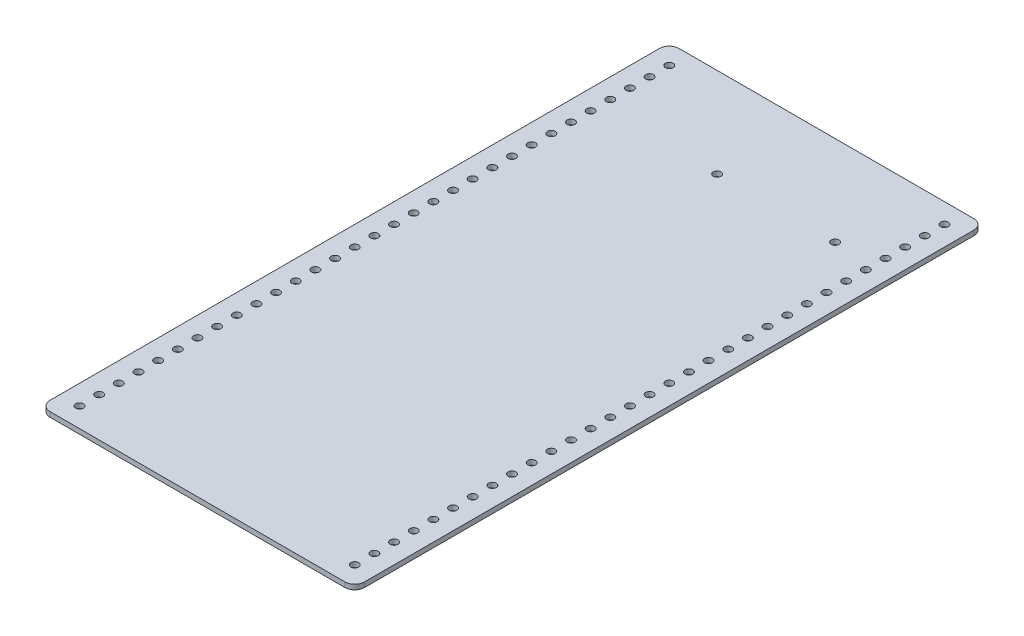
from build123d import *

# Parameters (mm, degrees)
BOSS_EXTRUDE1_DEPTH = 3.175
SKETCH3_R           = 2.5
CUT_EXTRUDE2_DEPTH  = 312.626023698
SKETCH7_R           = 2.5
CUT_EXTRUDE5_DEPTH  = 312.626023698


with BuildPart() as part:
    # Sketch1 → Boss-Extrude1 (new body)
    with BuildSketch(Plane(origin=(0, 0, 0), x_dir=(1, 0, 0), z_dir=(0, 1, 0))):
        with BuildLine():
            Line((-77.88977591, 288.008963585), (112.61022409, 288.008963585))
            ThreePointArc((112.61022409, 288.008963585), (117.10035215, 286.149091646), (118.96022409, 281.658963585))
            Line((118.96022409, 281.658963585), (118.96022409, -112.041036415))
            ThreePointArc((118.96022409, -112.041036415), (117.10035215, -116.531164475), (112.61022409, -118.391036415))
            Line((112.61022409, -118.391036415), (-77.88977591, -118.391036415))
            ThreePointArc((-77.88977591, -118.391036415), (-82.379903971, -116.531164475), (-84.23977591, -112.041036415))
            Line((-84.23977591, -112.041036415), (-84.23977591, 281.658963585))
            ThreePointArc((-84.23977591, 281.658963585), (-82.379903971, 286.149091646), (-77.88977591, 288.008963585))
        make_face()
    extrude(amount=BOSS_EXTRUDE1_DEPTH)

    # Sketch3 → Cut-Extrude2 (cut, through all)
    with BuildSketch(Plane(origin=(0, 3.175, 0), x_dir=(1, 0, 0), z_dir=(0, 1, 0))):
        with Locations((-71.53977591, 275.308963585)):
            Circle(SKETCH3_R)
        with Locations((106.26022409, 275.308963585)):
            Circle(SKETCH3_R)
        with Locations((-71.53977591, 262.608963585)):
            Circle(SKETCH3_R)
        with Locations((106.26022409, 262.608963585)):
            Circle(SKETCH3_R)
        with Locations((-71.53977591, 249.908963585)):
            Circle(SKETCH3_R)
        with Locations((106.26022409, 249.908963585)):
            Circle(SKETCH3_R)
        with Locations((-71.53977591, 237.208963585)):
            Circle(SKETCH3_R)
        with Locations((106.26022409, 237.208963585)):
            Circle(SKETCH3_R)
        with Locations((-71.53977591, 224.508963585)):
            Circle(SKETCH3_R)
        with Locations((106.26022409, 224.508963585)):
            Circle(SKETCH3_R)
        with Locations((-71.53977591, 211.808963585)):
            Circle(SKETCH3_R)
        with Locations((106.26022409, 211.808963585)):
            Circle(SKETCH3_R)
        with Locations((-71.53977591, 199.108963585)):
            Circle(SKETCH3_R)
        with Locations((106.26022409, 199.108963585)):
            Circle(SKETCH3_R)
        with Locations((-71.53977591, 186.408963585)):
            Circle(SKETCH3_R)
        with Locations((106.26022409, 186.408963585)):
            Circle(SKETCH3_R)
        with Locations((-71.53977591, 173.708963585)):
            Circle(SKETCH3_R)
        with Locations((106.26022409, 173.708963585)):
            Circle(SKETCH3_R)
        with Locations((-71.53977591, 161.008963585)):
            Circle(SKETCH3_R)
        with Locations((106.26022409, 161.008963585)):
            Circle(SKETCH3_R)
        with Locations((-71.53977591, 148.308963585)):
            Circle(SKETCH3_R)
        with Locations((106.26022409, 148.308963585)):
            Circle(SKETCH3_R)
        with Locations((-71.53977591, 135.608963585)):
            Circle(SKETCH3_R)
        with Locations((106.26022409, 135.608963585)):
            Circle(SKETCH3_R)
        with Locations((-71.53977591, 122.908963585)):
            Circle(SKETCH3_R)
        with Locations((106.26022409, 122.908963585)):
            Circle(SKETCH3_R)
        with Locations((-71.53977591, 110.208963585)):
            Circle(SKETCH3_R)
        with Locations((106.26022409, 110.208963585)):
            Circle(SKETCH3_R)
        with Locations((-71.53977591, 97.508963585)):
            Circle(SKETCH3_R)
        with Locations((106.26022409, 97.508963585)):
            Circle(SKETCH3_R)
        with Locations((-71.53977591, 84.808963585)):
            Circle(SKETCH3_R)
        with Locations((106.26022409, 84.808963585)):
            Circle(SKETCH3_R)
        with Locations((-71.53977591, 72.108963585)):
            Circle(SKETCH3_R)
        with Locations((106.26022409, 72.108963585)):
            Circle(SKETCH3_R)
        with Locations((-71.53977591, 59.408963585)):
            Circle(SKETCH3_R)
        with Locations((106.26022409, 59.408963585)):
            Circle(SKETCH3_R)
        with Locations((-71.53977591, 46.708963585)):
            Circle(SKETCH3_R)
        with Locations((106.26022409, 46.708963585)):
            Circle(SKETCH3_R)
        with Locations((-71.53977591, 34.008963585)):
            Circle(SKETCH3_R)
        with Locations((106.26022409, 34.008963585)):
            Circle(SKETCH3_R)
        with Locations((-71.53977591, 21.308963585)):
            Circle(SKETCH3_R)
        with Locations((106.26022409, 21.308963585)):
            Circle(SKETCH3_R)
        with Locations((-71.53977591, 8.608963585)):
            Circle(SKETCH3_R)
        with Locations((106.26022409, 8.608963585)):
            Circle(SKETCH3_R)
        with Locations((-71.53977591, -4.091036415)):
            Circle(SKETCH3_R)
        with Locations((106.26022409, -4.091036415)):
            Circle(SKETCH3_R)
        with Locations((-71.53977591, -16.791036415)):
            Circle(SKETCH3_R)
        with Locations((106.26022409, -16.791036415)):
            Circle(SKETCH3_R)
        with Locations((-71.53977591, -29.491036415)):
            Circle(SKETCH3_R)
        with Locations((106.26022409, -29.491036415)):
            Circle(SKETCH3_R)
        with Locations((-71.53977591, -42.191036415)):
            Circle(SKETCH3_R)
        with Locations((106.26022409, -42.191036415)):
            Circle(SKETCH3_R)
        with Locations((-71.53977591, -54.891036415)):
            Circle(SKETCH3_R)
        with Locations((106.26022409, -54.891036415)):
            Circle(SKETCH3_R)
        with Locations((-71.53977591, -67.591036415)):
            Circle(SKETCH3_R)
        with Locations((106.26022409, -67.591036415)):
            Circle(SKETCH3_R)
        with Locations((-71.53977591, -80.291036415)):
            Circle(SKETCH3_R)
        with Locations((106.26022409, -80.291036415)):
            Circle(SKETCH3_R)
        with Locations((-71.53977591, -92.991036415)):
            Circle(SKETCH3_R)
        with Locations((106.26022409, -92.991036415)):
            Circle(SKETCH3_R)
        with Locations((-71.53977591, -105.691036415)):
            Circle(SKETCH3_R)
        with Locations((106.26022409, -105.691036415)):
            Circle(SKETCH3_R)
    extrude(amount=-CUT_EXTRUDE2_DEPTH, mode=Mode.SUBTRACT)

    # Sketch7 → Cut-Extrude5 (cut, through all)
    with BuildSketch(Plane(origin=(0, 3.175, 0), x_dir=(1, 0, 0), z_dir=(0, 1, 0))):
        with Locations((80.895247822, 229.993789864)):
            Circle(SKETCH7_R)
        with Locations((4.695247822, 229.993789864)):
            Circle(SKETCH7_R)
    extrude(amount=-CUT_EXTRUDE5_DEPTH, mode=Mode.SUBTRACT)


solid = part.part
